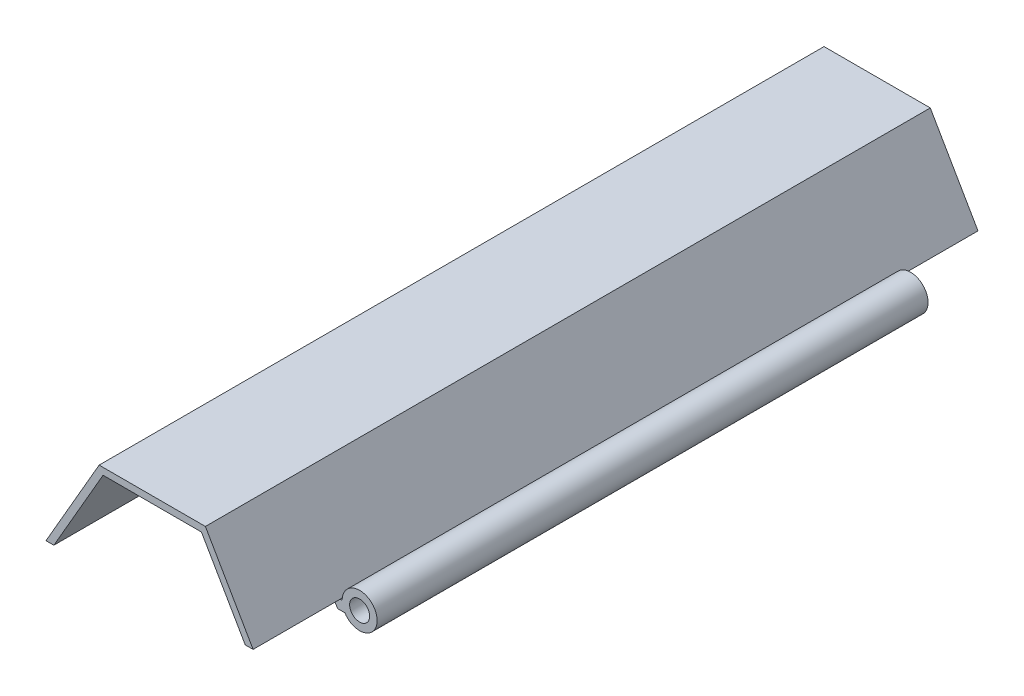
from build123d import *

# Parameters (mm, degrees)
SKETCH1_R           = 2.54
BOSS_EXTRUDE1_DEPTH = 184.2
CUT_EXTRUDE4_START  = -22.098
CUT_EXTRUDE4_DEPTH  = 22.098
CUT_EXTRUDE5_DEPTH  = 22.098


with BuildPart() as part:
    # Sketch1 → Boss-Extrude1 (new body)
    with BuildSketch(Plane.XY):
        with BuildLine():
            Line((-13.5, 23.382685902), (-27, 0))
            Line((-27, 0), (-25, 0))
            Line((-25, 0), (-12.5, 21.650635095))
            Line((-12.5, 21.650635095), (12.5, 21.650635095))
            Line((12.5, 21.650635095), (25, 0))
            Line((25, 0), (26.841758653, 0))
            ThreePointArc((26.841758653, 0), (34.864700777, 3.619120342), (26.150906359, 2.38))
            Line((26.150906359, 2.38), (25.625906359, 2.38))
            Line((25.625906359, 2.38), (13.5, 23.382685902))
            Line((13.5, 23.382685902), (-13.5, 23.382685902))
        make_face()
        with Locations((30.595906359, 2.38)):
            Circle(SKETCH1_R, mode=Mode.SUBTRACT)
    extrude(amount=BOSS_EXTRUDE1_DEPTH)

    # Sketch5 → Cut-Extrude4 (cut)
    with BuildSketch(Plane.XY.offset(184.2).offset(CUT_EXTRUDE4_START)):
        with BuildLine():
            Line((23.625906359, 2.38), (26.150906359, 2.38))
            ThreePointArc((26.150906359, 2.38), (34.864700777, 3.619120342), (26.841758653, 0))
            Line((26.841758653, 0), (25, 0))
            Line((25, 0), (23.625906359, 2.38))
        make_face()
    extrude(amount=CUT_EXTRUDE4_DEPTH, mode=Mode.SUBTRACT)

    # Sketch6 → Cut-Extrude5 (cut)
    with BuildSketch(Plane(origin=(0, 0, 0), x_dir=(-1, 0, 0), z_dir=(0, 0, -1))):
        with BuildLine():
            Line((-23.625906359, 2.38), (-26.150906359, 2.38))
            ThreePointArc((-26.150906359, 2.38), (-34.864700777, 3.619120342), (-26.841758653, 0))
            Line((-26.841758653, 0), (-25, 0))
            Line((-25, 0), (-23.625906359, 2.38))
        make_face()
    extrude(amount=-CUT_EXTRUDE5_DEPTH, mode=Mode.SUBTRACT)


solid = part.part
